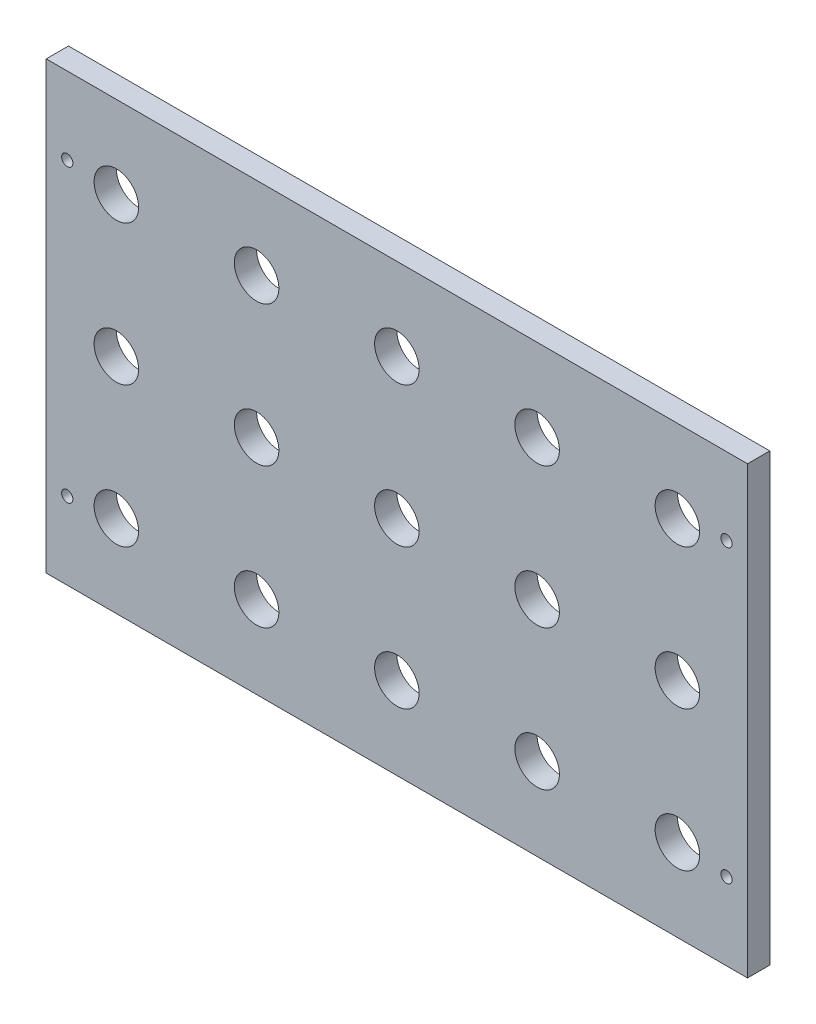
from build123d import *

# Parameters (mm, degrees)
SKETCH1_W          = 200
SKETCH1_H          = 127
SKETCH1_R          = 1.6
WALL_DEPTH         = 6.35
CANNULAHOLES_REACH = 239.001
SKETCH4_R          = 6.35


with BuildPart() as part:
    # Sketch1 → Wall (new body)
    with BuildSketch(Plane.XY):
        with Locations((100, 63.5)):
            Rectangle(SKETCH1_W, SKETCH1_H)
        with Locations((6, 105)):
            Circle(SKETCH1_R, mode=Mode.SUBTRACT)
        with Locations((6, 22)):
            Circle(SKETCH1_R, mode=Mode.SUBTRACT)
        with Locations((194, 22)):
            Circle(SKETCH1_R, mode=Mode.SUBTRACT)
        with Locations((194, 105)):
            Circle(SKETCH1_R, mode=Mode.SUBTRACT)
    extrude(amount=WALL_DEPTH)

    # Sketch4 → CannulaHoles (cut, up to next)
    with BuildSketch(Plane.XY.offset(6.35), mode=Mode.PRIVATE) as cannulaholes_sk1:
        with Locations((60, 103.5)):
            Circle(SKETCH4_R)
    cannulaholes_tool1 = extrude(cannulaholes_sk1.sketch, amount=-CANNULAHOLES_REACH, mode=Mode.PRIVATE) & part.part
    # Sketch4 → CannulaHoles (cut, up to next)
    with BuildSketch(Plane.XY.offset(6.35), mode=Mode.PRIVATE) as cannulaholes_sk2:
        with Locations((20, 103.5)):
            Circle(SKETCH4_R)
    cannulaholes_tool2 = extrude(cannulaholes_sk2.sketch, amount=-CANNULAHOLES_REACH, mode=Mode.PRIVATE) & part.part
    # Sketch4 → CannulaHoles (cut, up to next)
    with BuildSketch(Plane.XY.offset(6.35), mode=Mode.PRIVATE) as cannulaholes_sk3:
        with Locations((100, 103.5)):
            Circle(SKETCH4_R)
    cannulaholes_tool3 = extrude(cannulaholes_sk3.sketch, amount=-CANNULAHOLES_REACH, mode=Mode.PRIVATE) & part.part
    # Sketch4 → CannulaHoles (cut, up to next)
    with BuildSketch(Plane.XY.offset(6.35), mode=Mode.PRIVATE) as cannulaholes_sk4:
        with Locations((140, 103.5)):
            Circle(SKETCH4_R)
    cannulaholes_tool4 = extrude(cannulaholes_sk4.sketch, amount=-CANNULAHOLES_REACH, mode=Mode.PRIVATE) & part.part
    # Sketch4 → CannulaHoles (cut, up to next)
    with BuildSketch(Plane.XY.offset(6.35), mode=Mode.PRIVATE) as cannulaholes_sk5:
        with Locations((60, 63.5)):
            Circle(SKETCH4_R)
    cannulaholes_tool5 = extrude(cannulaholes_sk5.sketch, amount=-CANNULAHOLES_REACH, mode=Mode.PRIVATE) & part.part
    # Sketch4 → CannulaHoles (cut, up to next)
    with BuildSketch(Plane.XY.offset(6.35), mode=Mode.PRIVATE) as cannulaholes_sk6:
        with Locations((100, 63.5)):
            Circle(SKETCH4_R)
    cannulaholes_tool6 = extrude(cannulaholes_sk6.sketch, amount=-CANNULAHOLES_REACH, mode=Mode.PRIVATE) & part.part
    # Sketch4 → CannulaHoles (cut, up to next)
    with BuildSketch(Plane.XY.offset(6.35), mode=Mode.PRIVATE) as cannulaholes_sk7:
        with Locations((140, 63.5)):
            Circle(SKETCH4_R)
    cannulaholes_tool7 = extrude(cannulaholes_sk7.sketch, amount=-CANNULAHOLES_REACH, mode=Mode.PRIVATE) & part.part
    # Sketch4 → CannulaHoles (cut, up to next)
    with BuildSketch(Plane.XY.offset(6.35), mode=Mode.PRIVATE) as cannulaholes_sk8:
        with Locations((60, 23.5)):
            Circle(SKETCH4_R)
    cannulaholes_tool8 = extrude(cannulaholes_sk8.sketch, amount=-CANNULAHOLES_REACH, mode=Mode.PRIVATE) & part.part
    # Sketch4 → CannulaHoles (cut, up to next)
    with BuildSketch(Plane.XY.offset(6.35), mode=Mode.PRIVATE) as cannulaholes_sk9:
        with Locations((100, 23.5)):
            Circle(SKETCH4_R)
    cannulaholes_tool9 = extrude(cannulaholes_sk9.sketch, amount=-CANNULAHOLES_REACH, mode=Mode.PRIVATE) & part.part
    # Sketch4 → CannulaHoles (cut, up to next)
    with BuildSketch(Plane.XY.offset(6.35), mode=Mode.PRIVATE) as cannulaholes_sk10:
        with Locations((140, 23.5)):
            Circle(SKETCH4_R)
    cannulaholes_tool10 = extrude(cannulaholes_sk10.sketch, amount=-CANNULAHOLES_REACH, mode=Mode.PRIVATE) & part.part
    # Sketch4 → CannulaHoles (cut, up to next)
    with BuildSketch(Plane.XY.offset(6.35), mode=Mode.PRIVATE) as cannulaholes_sk11:
        with Locations((20, 63.5)):
            Circle(SKETCH4_R)
    cannulaholes_tool11 = extrude(cannulaholes_sk11.sketch, amount=-CANNULAHOLES_REACH, mode=Mode.PRIVATE) & part.part
    # Sketch4 → CannulaHoles (cut, up to next)
    with BuildSketch(Plane.XY.offset(6.35), mode=Mode.PRIVATE) as cannulaholes_sk12:
        with Locations((20, 23.5)):
            Circle(SKETCH4_R)
    cannulaholes_tool12 = extrude(cannulaholes_sk12.sketch, amount=-CANNULAHOLES_REACH, mode=Mode.PRIVATE) & part.part
    # Sketch4 → CannulaHoles (cut, up to next)
    with BuildSketch(Plane.XY.offset(6.35), mode=Mode.PRIVATE) as cannulaholes_sk13:
        with Locations((180, 103.5)):
            Circle(SKETCH4_R)
    cannulaholes_tool13 = extrude(cannulaholes_sk13.sketch, amount=-CANNULAHOLES_REACH, mode=Mode.PRIVATE) & part.part
    # Sketch4 → CannulaHoles (cut, up to next)
    with BuildSketch(Plane.XY.offset(6.35), mode=Mode.PRIVATE) as cannulaholes_sk14:
        with Locations((180, 63.5)):
            Circle(SKETCH4_R)
    cannulaholes_tool14 = extrude(cannulaholes_sk14.sketch, amount=-CANNULAHOLES_REACH, mode=Mode.PRIVATE) & part.part
    # Sketch4 → CannulaHoles (cut, up to next)
    with BuildSketch(Plane.XY.offset(6.35), mode=Mode.PRIVATE) as cannulaholes_sk15:
        with Locations((180, 23.5)):
            Circle(SKETCH4_R)
    cannulaholes_tool15 = extrude(cannulaholes_sk15.sketch, amount=-CANNULAHOLES_REACH, mode=Mode.PRIVATE) & part.part
    add(cannulaholes_tool1.solids().sort_by_distance((60, 103.5, 6.35))[0], mode=Mode.SUBTRACT)
    add(cannulaholes_tool2.solids().sort_by_distance((20, 103.5, 6.35))[0], mode=Mode.SUBTRACT)
    add(cannulaholes_tool3.solids().sort_by_distance((100, 103.5, 6.35))[0], mode=Mode.SUBTRACT)
    add(cannulaholes_tool4.solids().sort_by_distance((140, 103.5, 6.35))[0], mode=Mode.SUBTRACT)
    add(cannulaholes_tool5.solids().sort_by_distance((60, 63.5, 6.35))[0], mode=Mode.SUBTRACT)
    add(cannulaholes_tool6.solids().sort_by_distance((100, 63.5, 6.35))[0], mode=Mode.SUBTRACT)
    add(cannulaholes_tool7.solids().sort_by_distance((140, 63.5, 6.35))[0], mode=Mode.SUBTRACT)
    add(cannulaholes_tool8.solids().sort_by_distance((60, 23.5, 6.35))[0], mode=Mode.SUBTRACT)
    add(cannulaholes_tool9.solids().sort_by_distance((100, 23.5, 6.35))[0], mode=Mode.SUBTRACT)
    add(cannulaholes_tool10.solids().sort_by_distance((140, 23.5, 6.35))[0], mode=Mode.SUBTRACT)
    add(cannulaholes_tool11.solids().sort_by_distance((20, 63.5, 6.35))[0], mode=Mode.SUBTRACT)
    add(cannulaholes_tool12.solids().sort_by_distance((20, 23.5, 6.35))[0], mode=Mode.SUBTRACT)
    add(cannulaholes_tool13.solids().sort_by_distance((180, 103.5, 6.35))[0], mode=Mode.SUBTRACT)
    add(cannulaholes_tool14.solids().sort_by_distance((180, 63.5, 6.35))[0], mode=Mode.SUBTRACT)
    add(cannulaholes_tool15.solids().sort_by_distance((180, 23.5, 6.35))[0], mode=Mode.SUBTRACT)


solid = part.part
